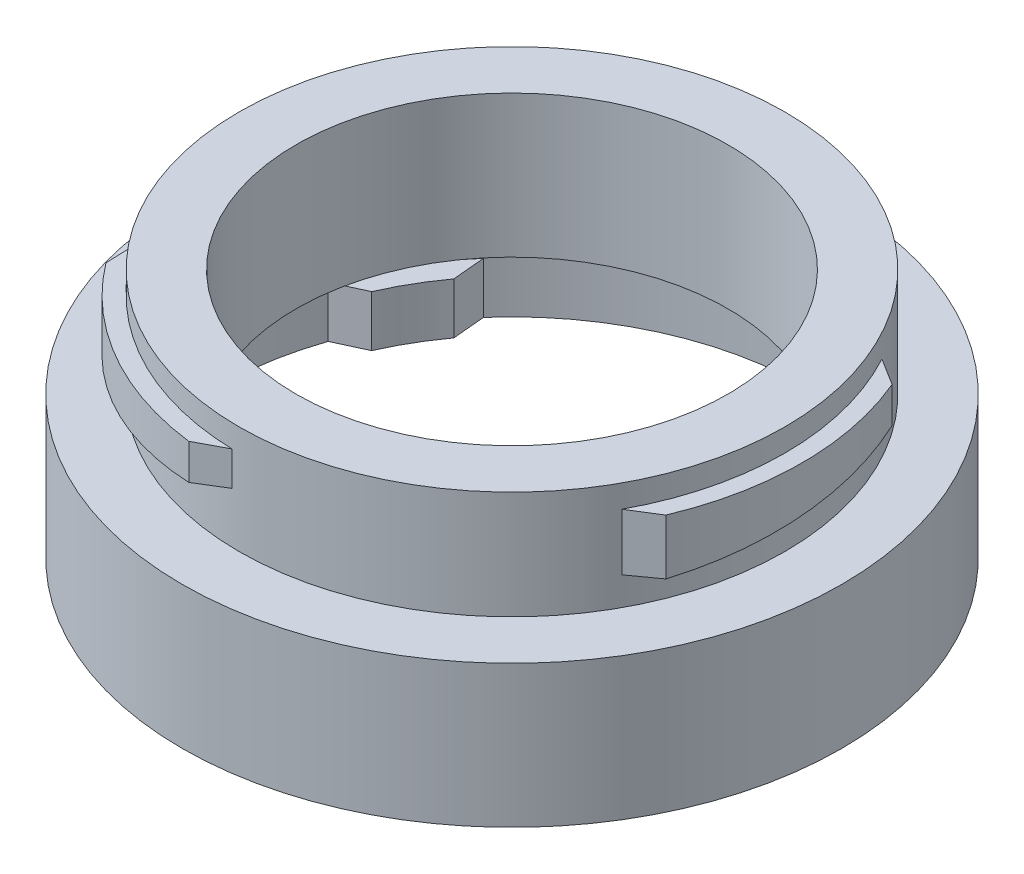
from build123d import *
from build123d.topology import SkipClean

# Parameters (mm, degrees)
CUT_EXTRUDE_START        = -10
CUT_EXTRUDE_1_DEPTH      = 10
EXTRUDE_1_DEPTH          = 6
PATTERN_CIRCULAR_1_COUNT = 3
SKETCH_4_R               = 42.404307435
SKETCH_4_R_2             = 25.5
CUT_EXTRUDE_2_DEPTH      = 9.5
CHAMFER_START            = 14
CHAMFER_1_DEPTH          = 6


with BuildPart() as part:
    # Эскиз1 → Повернуть1 (revolve)
    with BuildSketch(Plane.XY, mode=Mode.PRIVATE) as revolve_1_sk:
        Polygon((-24, 0), (-24, 4.5), (-26, 4.5), (-26, 9.5), (-19, 9.5), (-19, 22), (-24, 22), (-24, 12.5), (-29, 12.5), (-29, 0), align=None)
    revolve(revolve_1_sk.sketch.rotate(Axis((0, 0, 0), (0, -1, 0)), 270), axis=Axis((0, 0, 0), (0, -1, 0)))

    # Эскиз2 → Вырез-Вытянуть1 (cut)
    with SkipClean():  # the faces are left unmerged after this step: merging them gives an invalid solid
        with BuildSketch(Plane(origin=(0, 0, 0), x_dir=(-1, 0, 0), z_dir=(0, -1, 0)).offset(CUT_EXTRUDE_START)):
            with BuildLine():
                ThreePointArc((24, 0), (17.8818714, -16.007456864), (2.646777063, -23.85360709))
                Line((2.646777063, -23.85360709), (5, -25.514701644))
                ThreePointArc((5, -25.514701644), (20.0748599, -16.522711642), (26, 0))
                ThreePointArc((26, 0), (25.646694472, 4.271658071), (24.596379794, 8.427223803))
                Line((24.596379794, 8.427223803), (21.981218243, 9.63462737))
                ThreePointArc((21.981218243, 9.63462737), (23.489883331, 4.921928594), (24, 0))
            make_face()
            with BuildLine():
                Line((-5, -25.514701644), (-2.646777063, -23.85360709))
                ThreePointArc((-2.646777063, -23.85360709), (-20.784609691, -12), (-21.981218243, 9.63462737))
                Line((-21.981218243, 9.63462737), (-24.596379794, 8.427223803))
                ThreePointArc((-24.596379794, 8.427223803), (-22.516660498, -13), (-5, -25.514701644))
            make_face()
            with BuildLine():
                Line((-19.596379794, 17.087477841), (-19.33444118, 14.218979719))
                ThreePointArc((-19.33444118, 14.218979719), (0, 24), (19.33444118, 14.218979719))
                Line((19.33444118, 14.218979719), (19.596379794, 17.087477841))
                ThreePointArc((19.596379794, 17.087477841), (0, 26), (-19.596379794, 17.087477841))
            make_face()
        extrude(amount=CUT_EXTRUDE_1_DEPTH, mode=Mode.SUBTRACT)

    # Эскиз3 → Бобышка-Вытянуть1 (add)
    with SkipClean():  # the faces are left unmerged after this step: merging them gives an invalid solid
        with BuildSketch(Plane(origin=(25.5, 0, 0), x_dir=(0, 0, -1), z_dir=(1, 0, 0))):
            Polygon((-11.5, 20), (11.5, 20), (11.5, 17), (-11.5, 15), align=None)
        extrude_1 = extrude(amount=-EXTRUDE_1_DEPTH)

    # Круговой массив1: Бобышка-Вытянуть1 ×3 about axis
    with SkipClean():  # the faces are left unmerged after this step: merging them gives an invalid solid
        pattern_circular_1_axis = Axis((0, 0, 0), (0, 1, 0))
        for i in range(1, PATTERN_CIRCULAR_1_COUNT):
            add(extrude_1.rotate(pattern_circular_1_axis, i * 360 / PATTERN_CIRCULAR_1_COUNT))

    # Эскиз4 → Вырез-Вытянуть2 (cut)
    with SkipClean():  # the faces are left unmerged after this step: merging them gives an invalid solid
        with BuildSketch(Plane(origin=(0, 22, 0), x_dir=(1, 0, 0), z_dir=(0, 1, 0))):
            Circle(SKETCH_4_R)
            Circle(SKETCH_4_R_2, mode=Mode.SUBTRACT)
        extrude(amount=-CUT_EXTRUDE_2_DEPTH, mode=Mode.SUBTRACT)

    # Фаска1: read off the stored shape, not the designer's step
    # Фаска1 outline → Фаска1 (cut)
    with SkipClean():  # the faces are left unmerged after this step: merging them gives an invalid solid
        with BuildSketch(Plane(origin=(0, 0, 0), x_dir=(1, 0, 0), z_dir=(0, 1, 0)).offset(CHAMFER_START)):
            with BuildLine():
                Line((-20.456443185, 12.551252218), (-20.356857991, 15.357354354))
                ThreePointArc((-20.356857991, 15.357354354), (-20.859675731, 14.667103612), (-21.33909882, 13.960403344))
                Line((-21.33909882, 13.960403344), (-20.49197936, 12.493149399))
                ThreePointArc((-20.49197936, 12.493149399), (-20.474231883, 12.522213414), (-20.456443185, 12.551252218))
            make_face()
            with BuildLine():
                ThreePointArc((-1.420514533, 25.460403344), (-2.272246462, 25.398560904), (-3.12143001, 25.308233338))
                Line((-3.12143001, 25.308233338), (-0.641481678, 23.991425578))
                ThreePointArc((-0.641481678, 23.991425578), (-0.607438987, 23.992311641), (-0.573395073, 23.993149399))
                Line((-0.573395073, 23.993149399), (-1.420514533, 25.460403344))
            make_face()
            with BuildLine():
                ThreePointArc((-20.456443185, -12.551252218), (-20.474231883, -12.522213414), (-20.49197936, -12.493149399))
                Line((-20.49197936, -12.493149399), (-21.33909882, -13.960403344))
                ThreePointArc((-21.33909882, -13.960403344), (-20.859675731, -14.667103612), (-20.356857991, -15.357354354))
                Line((-20.356857991, -15.357354354), (-20.456443185, -12.551252218))
            make_face()
            with BuildLine():
                Line((22.759613353, 11.5), (21.065374433, 11.5))
                ThreePointArc((21.065374433, 11.5), (21.08167087, 11.470098227), (21.097924862, 11.44017336))
                Line((21.097924862, 11.44017336), (23.478288, 9.950878984))
                ThreePointArc((23.478288, 9.950878984), (23.131922194, 10.731457292), (22.759613353, 11.5))
            make_face()
            with BuildLine():
                ThreePointArc((-0.573395073, -23.993149399), (-0.607438987, -23.992311641), (-0.641481678, -23.991425578))
                Line((-0.641481678, -23.991425578), (-3.12143001, -25.308233338))
                ThreePointArc((-3.12143001, -25.308233338), (-2.272246462, -25.398560904), (-1.420514533, -25.460403344))
                Line((-1.420514533, -25.460403344), (-0.573395073, -23.993149399))
            make_face()
            with BuildLine():
                ThreePointArc((22.759613353, -11.5), (23.131922194, -10.731457292), (23.478288, -9.950878984))
                Line((23.478288, -9.950878984), (21.097924862, -11.44017336))
                ThreePointArc((21.097924862, -11.44017336), (21.08167087, -11.470098227), (21.065374433, -11.5))
                Line((21.065374433, -11.5), (22.759613353, -11.5))
            make_face()
        extrude(amount=CHAMFER_1_DEPTH, mode=Mode.SUBTRACT)


solid = part.part
